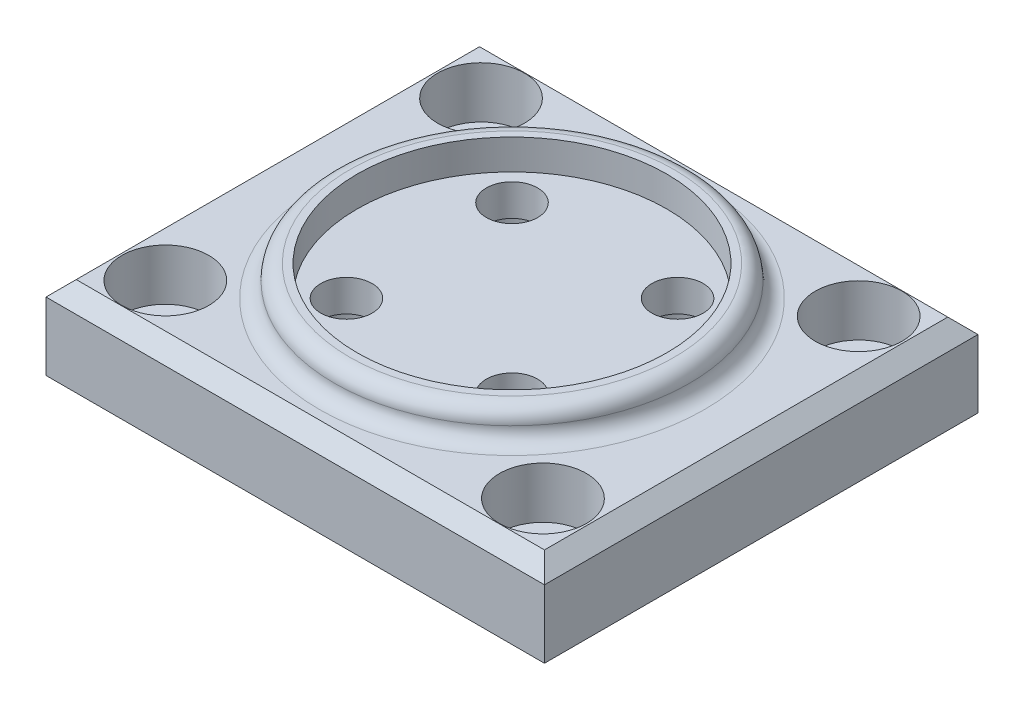
from build123d import *

# Parameters (mm, degrees)
SKETCH1_W                      = 33
SKETCH1_H                      = 28.7
BOSS_EXTRUDE1_DEPTH            = 5.5
CBORE_FOR_M3_SHCS1_D           = 3.4
CBORE_FOR_M3_SHCS1_CBORE_D     = 5.75
CBORE_FOR_M3_SHCS1_CBORE_DEPTH = 3.4
CBORE_FOR_M3_SHCS2_D           = 3.4
CBORE_FOR_M3_SHCS2_CBORE_D     = 5.75
CBORE_FOR_M3_SHCS2_CBORE_DEPTH = 3.4
SKETCH9_R                      = 11.75
SKETCH9_R_2                    = 10.25
BOSS_EXTRUDE2_DEPTH            = 2
FILLET1_R                      = 1
CHAMFER1_SIZE                  = 1


with BuildPart() as part:
    # Sketch1 → Boss-Extrude1 (new body)
    with BuildSketch(Plane(origin=(0, 0, 0), x_dir=(1, 0, 0), z_dir=(0, 1, 0))):
        Rectangle(SKETCH1_W, SKETCH1_H)
    extrude(amount=BOSS_EXTRUDE1_DEPTH)

    # CBORE for M3 SHCS1 (through all)
    with Locations(Plane(origin=(0, 5.5, 0), x_dir=(1, 0, 0), z_dir=(0, 1, 0))):
        with Locations((-12.5, 10.45), (12.5, 10.45), (12.5, -10.45), (-12.5, -10.45)):
            CounterBoreHole(CBORE_FOR_M3_SHCS1_D / 2, CBORE_FOR_M3_SHCS1_CBORE_D / 2, CBORE_FOR_M3_SHCS1_CBORE_DEPTH)

    # CBORE for M3 SHCS2 (through all)
    with Locations(Plane(origin=(0, 0, 0), x_dir=(-1, 0, 0), z_dir=(0, -1, 0))):
        with Locations((-5.480077554, -5.480077554), (5.480077554, -5.480077554), (5.480077554, 5.480077554), (-5.480077554, 5.480077554)):
            CounterBoreHole(CBORE_FOR_M3_SHCS2_D / 2, CBORE_FOR_M3_SHCS2_CBORE_D / 2, CBORE_FOR_M3_SHCS2_CBORE_DEPTH)

    # Sketch9 → Boss-Extrude2 (add)
    with BuildSketch(Plane(origin=(0, 5.5, 0), x_dir=(1, 0, 0), z_dir=(0, 1, 0))):
        with Locations(Location((0, 0, 0), (0, 0, 270))):
            Circle(SKETCH9_R)
        with Locations(Location((0, 0, 0), (0, 0, 270))):
            Circle(SKETCH9_R_2, mode=Mode.SUBTRACT)
    extrude(amount=BOSS_EXTRUDE2_DEPTH)

    # Fillet1
    fillet1_edges = [part.edges().sort_by_distance(p)[0] for p in [
        (0, 5.5, -11.75),
        (0, 7.5, -11.75),
    ]]
    fillet(fillet1_edges, radius=FILLET1_R - 0.0001)  # a hair under: the kernel refuses the full size

    # Chamfer1
    chamfer1_edges = [part.edges().sort_by_distance(p)[0] for p in [
        (16.5, 5.5, 0),
        (0, 5.5, -14.35),
        (-16.5, 5.5, 0),
        (0, 5.5, 14.35),
    ]]
    chamfer(chamfer1_edges, length=CHAMFER1_SIZE)


solid = part.part
